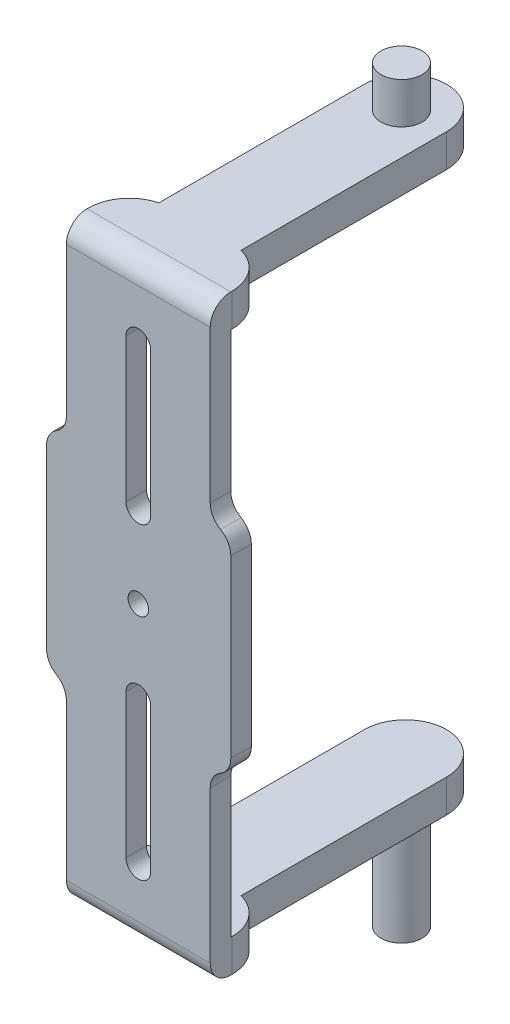
from build123d import *

# Parameters (mm, degrees)
SKETCH1_W             = 144
SKETCH1_H             = 35
BOSS_EXTRUDE1_DEPTH   = 5
BOSS_EXTRUDE2_DEPTH   = 8
FILLET1_R             = 10
BOSS_EXTRUDE3_DEPTH   = 8
SKETCH5_R             = 5
BOSS_EXTRUDE4_DEPTH   = 28
FILLET1_OF_MIRROR1_R  = 10
FILLET3_R             = 5
SKETCH7_R             = 2.5
CUT_EXTRUDE2_DEPTH    = 28
SKETCH8_R             = 5
CUT_EXTRUDE3_DEPTH    = 18
SKETCH9_W             = 50
SKETCH9_H             = 4.833302034
BOSS_EXTRUDE7_DEPTH   = 5
FILLET6_R             = 5
FILLET7_R             = 5
SKETCH10_W            = 50
SKETCH10_H            = 5
BOSS_EXTRUDE8_DEPTH   = 5
FILLET8_R             = 5
FILLET9_R             = 5
CUT_EXTRUDE6_DEPTH    = 10
BODY_MOVE_COPY1_ANGLE = 120


with BuildPart() as part:
    # Sketch1 → Boss-Extrude1 (new body)
    with BuildSketch(Plane(origin=(0, 0, 0), x_dir=(1, 0, 0), z_dir=(0, 1, 0))):
        Rectangle(SKETCH1_W, SKETCH1_H)
    boss_extrude1 = extrude(amount=BOSS_EXTRUDE1_DEPTH)

    # Sketch3 → Boss-Extrude2 (add)
    with BuildSketch(Plane.ZY.offset(72)):
        Polygon((-17.5, 5), (-17.5, 15), (-10, 15), (-10, 55), (10, 55), (10, 15), (17.5, 15), (17.5, 5), (0, 5), align=None)
    boss_extrude2 = extrude(amount=-BOSS_EXTRUDE2_DEPTH)

    # Fillet1
    # the kernel refuses this fillet: 10 mm, written as the material it takes off along each edge
    with BuildSketch(Plane(origin=(-96.206145914, 15, -17.5), x_dir=(0, -1, 0), z_dir=(1, 0, 0))) as fillet1_piece_1:
        with BuildLine():
            CenterArc((9.682458366, -10), FILLET1_R, 90, 75.522487814)
            Line((0, -7.5), (-0.193649167, -7.45))
            ThreePointArc((-0.193649167, -7.45), (-0.2, -3.75), (-0.2, 0))
            Line((-0.2, 0), (0, 0.2))
            Line((0, 0.2), (9.682458366, 0.2))
            Line((9.682458366, 0.2), (9.682458366, 0))
        make_face()
    extrude(amount=56.412291828, mode=Mode.SUBTRACT)
    with BuildSketch(Plane(origin=(-96.206145914, 15, 17.5), x_dir=(0, -1, 0), z_dir=(1, 0, 0))) as fillet1_piece_2:
        with BuildLine():
            CenterArc((9.682458366, 10), FILLET1_R, 194.477512186, 75.522487814)
            Line((0, 7.5), (-0.193649167, 7.45))
            ThreePointArc((-0.193649167, 7.45), (-0.2, 3.75), (-0.2, 0))
            Line((-0.2, 0), (0, -0.2))
            Line((0, -0.2), (9.682458366, -0.2))
            Line((9.682458366, -0.2), (9.682458366, 0))
        make_face()
    extrude(amount=56.412291828, mode=Mode.SUBTRACT)

    # Sketch4 → Boss-Extrude3 (add)
    with BuildSketch(Plane.ZY.offset(72)):
        with BuildLine():
            Line((-10, 55), (-10, 65))
            ThreePointArc((-10, 65), (0, 75), (10, 65))
            Line((10, 65), (10, 55))
            Line((10, 55), (-10, 55))
        make_face()
    boss_extrude3 = extrude(amount=-BOSS_EXTRUDE3_DEPTH)

    # Sketch5 → Boss-Extrude4 (add)
    with BuildSketch(Plane.ZY.offset(72)):
        with Locations(Location((0, 64.047898896, 0), (0, 0, 180))):
            Circle(SKETCH5_R)
    boss_extrude4 = extrude(amount=BOSS_EXTRUDE4_DEPTH)

    # Mirror1: Boss-Extrude1, Boss-Extrude2, Boss-Extrude3, Boss-Extrude4 across plane
    add(boss_extrude1.mirror(Plane(origin=(0, 0, 0), x_dir=(0, 0, 1), z_dir=(1, 0, 0))))
    add(boss_extrude2.mirror(Plane(origin=(0, 0, 0), x_dir=(0, 0, 1), z_dir=(1, 0, 0))))
    add(boss_extrude3.mirror(Plane(origin=(0, 0, 0), x_dir=(0, 0, 1), z_dir=(1, 0, 0))))
    add(boss_extrude4.mirror(Plane(origin=(0, 0, 0), x_dir=(0, 0, 1), z_dir=(1, 0, 0))))

    # Fillet1 of Mirror1
    # the kernel refuses this fillet: 10 mm, written as the material it takes off along each edge
    with BuildSketch(Plane(origin=(96.206145914, 15, -17.5), x_dir=(0, -1, 0), z_dir=(-1, 0, 0))) as fillet1_of_mirror1_piece_1:
        with BuildLine():
            CenterArc((9.682458366, 10), FILLET1_OF_MIRROR1_R, 194.477512186, 75.522487814)
            Line((0, 7.5), (-0.193649167, 7.45))
            ThreePointArc((-0.193649167, 7.45), (-0.2, 3.75), (-0.2, 0))
            Line((-0.2, 0), (0, -0.2))
            Line((0, -0.2), (9.682458366, -0.2))
            Line((9.682458366, -0.2), (9.682458366, 0))
        make_face()
    extrude(amount=56.412291828, mode=Mode.SUBTRACT)
    with BuildSketch(Plane(origin=(96.206145914, 15, 17.5), x_dir=(0, -1, 0), z_dir=(-1, 0, 0))) as fillet1_of_mirror1_piece_2:
        with BuildLine():
            CenterArc((9.682458366, -10), FILLET1_OF_MIRROR1_R, 90, 75.522487814)
            Line((0, -7.5), (-0.193649167, -7.45))
            ThreePointArc((-0.193649167, -7.45), (-0.2, -3.75), (-0.2, 0))
            Line((-0.2, 0), (0, 0.2))
            Line((0, 0.2), (9.682458366, 0.2))
            Line((9.682458366, 0.2), (9.682458366, 0))
        make_face()
    extrude(amount=56.412291828, mode=Mode.SUBTRACT)

    # Fillet3
    fillet3_edges = [part.edges().sort_by_distance(p)[0] for p in [
        (-72, 0, 0),
        (72, 0, 0),
    ]]
    fillet(fillet3_edges, radius=FILLET3_R)

    # Sketch7 → Cut-Extrude2 (cut)
    with BuildSketch(Plane(origin=(0, 5, 0), x_dir=(1, 0, 0), z_dir=(0, 1, 0))):
        with Locations(Location((0, 0, 0), (0, 0, 270))):
            Circle(SKETCH7_R)
    extrude(amount=-CUT_EXTRUDE2_DEPTH, mode=Mode.SUBTRACT)

    # Sketch8 → Cut-Extrude3 (cut)
    with BuildSketch(Plane(origin=(100, 0, 0), x_dir=(0, 0, -1), z_dir=(1, 0, 0))):
        with Locations(Location((0, 64.047898896, 0), (0, 0, 180))):
            Circle(SKETCH8_R)
    extrude(amount=-CUT_EXTRUDE3_DEPTH, mode=Mode.SUBTRACT)

    # Sketch9 → Boss-Extrude7 (add)
    with BuildSketch(Plane.XZ):
        with Locations((0.833489832, 19.916651017)):
            Rectangle(SKETCH9_W, SKETCH9_H)
    extrude(amount=-BOSS_EXTRUDE7_DEPTH)

    # Fillet6
    # the kernel refuses this fillet: 5 mm, written as the material it adds along each edge
    with BuildSketch(Plane(origin=(-24.166510168, 0, 17.5), x_dir=(-1, 0, 0), z_dir=(0, 1, 0))) as fillet6_piece_1:
        with BuildLine():
            CenterArc((4.997220406, 5), FILLET6_R, 181.91057204, 88.08942796)
            Line((0, 4.833302034), (-0.099944408, 4.829968074))
            ThreePointArc((-0.099944408, 4.829968074), (-0.1, 2.416651017), (-0.1, 0))
            Line((-0.1, 0), (0, -0.1))
            Line((0, -0.1), (4.997220406, -0.1))
            Line((4.997220406, -0.1), (4.997220406, 0))
        make_face()
    extrude(amount=5)
    with BuildSketch(Plane(origin=(25.833489832, 0, 17.5), x_dir=(1, 0, 0), z_dir=(0, 1, 0))) as fillet6_piece_2:
        with BuildLine():
            CenterArc((4.997220406, -5), FILLET6_R, 90, 88.08942796)
            Line((0, -4.833302034), (-0.099944408, -4.829968074))
            ThreePointArc((-0.099944408, -4.829968074), (-0.1, -2.416651017), (-0.1, 0))
            Line((-0.1, 0), (0, 0.1))
            Line((0, 0.1), (4.997220406, 0.1))
            Line((4.997220406, 0.1), (4.997220406, 0))
        make_face()
    extrude(amount=5)

    # Fillet7
    fillet7_edges = [part.edges().sort_by_distance(p)[0] for p in [
        (-24.166510168, 2.5, 22.333302034),
        (25.833489832, 2.5, 22.333302034),
    ]]
    fillet(fillet7_edges, radius=FILLET7_R)

    # Sketch10 → Boss-Extrude8 (add)
    with BuildSketch(Plane.XZ):
        with Locations((0, -20)):
            Rectangle(SKETCH10_W, SKETCH10_H)
    extrude(amount=-BOSS_EXTRUDE8_DEPTH)

    # Fillet8
    fillet8_edges = [part.edges().sort_by_distance(p)[0] for p in [
        (-25, 2.5, -17.5),
        (25, 2.5, -17.5),
    ]]
    fillet(fillet8_edges, radius=FILLET8_R - 0.0001)  # a hair under: the kernel refuses the full size

    # Fillet9
    fillet9_edges = [part.edges().sort_by_distance(p)[0] for p in [
        (-25, 2.5, -22.5),
        (25, 2.5, -22.5),
    ]]
    fillet(fillet9_edges, radius=FILLET9_R)

    # Sketch11 → Cut-Extrude6 (cut)
    with BuildSketch(Plane(origin=(0, 5, 0), x_dir=(1, 0, 0), z_dir=(0, 1, 0))):
        with BuildLine():
            Line((55, -3), (20, -3))
            ThreePointArc((20, -3), (17, 0), (20, 3))
            Line((20, 3), (55, 3))
            ThreePointArc((55, 3), (58, 0), (55, -3))
        make_face()
        with BuildLine():
            Line((-55, -3), (-20, -3))
            ThreePointArc((-20, -3), (-17, 0), (-20, 3))
            Line((-20, 3), (-55, 3))
            ThreePointArc((-55, 3), (-58, 0), (-55, -3))
        make_face()
    extrude(amount=-CUT_EXTRUDE6_DEPTH, mode=Mode.SUBTRACT)


with BuildPart() as part_1:
    # Body-Move/Copy1: read off the stored shape, not the designer's step
    # Body-Move/Copy1: moved
    add(part.part.moved(Location((64, -64.0478989, 0))).rotate(Axis((0, 0, 0), (-0.5773502692, -0.5773502692, 0.5773502692)), BODY_MOVE_COPY1_ANGLE))


solid = part_1.part
